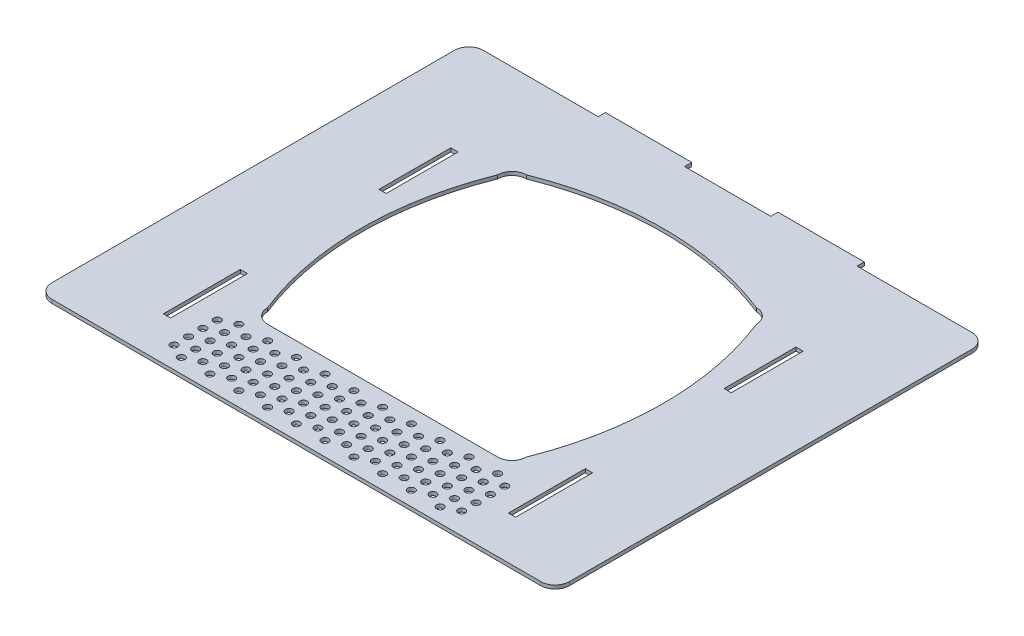
from build123d import *

# Parameters (mm, degrees)
SKETCH1_5_R         = 2.5
SKETCH1_5_W         = 5
SKETCH1_5_H         = 53.5
SKETCH1_5_H_2       = 50
BOSS_EXTRUDE4_DEPTH = 2.5
FILLET1_R           = 10


with BuildPart() as part:
    # Sketch1<5> → Boss-Extrude4 (new body)
    with BuildSketch(Plane(origin=(0, 0, 0), x_dir=(1, 0, 0), z_dir=(0, 1, 0))):
        Polygon((-90, 150), (-180, 150), (-180, -150), (180, -150), (180, 150), (90, 150), (90, 155), (30, 155), (30, 150), (-30, 150), (-30, 155), (-90, 155), align=None)
        with Locations((-90, -140)):
            Circle(SKETCH1_5_R, mode=Mode.SUBTRACT)
        with Locations((-100, -135)):
            Circle(SKETCH1_5_R, mode=Mode.SUBTRACT)
        with Locations((-90, -130)):
            Circle(SKETCH1_5_R, mode=Mode.SUBTRACT)
        with Locations((-100, -125)):
            Circle(SKETCH1_5_R, mode=Mode.SUBTRACT)
        with Locations((-90, -120)):
            Circle(SKETCH1_5_R, mode=Mode.SUBTRACT)
        with Locations((-100, -115)):
            Circle(SKETCH1_5_R, mode=Mode.SUBTRACT)
        with Locations((-120, -93.25)):
            Rectangle(SKETCH1_5_W, SKETCH1_5_H, mode=Mode.SUBTRACT)
        with Locations((-90, -110)):
            Circle(SKETCH1_5_R, mode=Mode.SUBTRACT)
        with Locations((-100, -105)):
            Circle(SKETCH1_5_R, mode=Mode.SUBTRACT)
        with Locations((-90, -100)):
            Circle(SKETCH1_5_R, mode=Mode.SUBTRACT)
        with Locations((-80, -135)):
            Circle(SKETCH1_5_R, mode=Mode.SUBTRACT)
        with Locations((-70, -140)):
            Circle(SKETCH1_5_R, mode=Mode.SUBTRACT)
        with Locations((-60, -135)):
            Circle(SKETCH1_5_R, mode=Mode.SUBTRACT)
        with Locations((-50, -140)):
            Circle(SKETCH1_5_R, mode=Mode.SUBTRACT)
        with Locations((-80, -125)):
            Circle(SKETCH1_5_R, mode=Mode.SUBTRACT)
        with Locations((-70, -130)):
            Circle(SKETCH1_5_R, mode=Mode.SUBTRACT)
        with Locations((-80, -115)):
            Circle(SKETCH1_5_R, mode=Mode.SUBTRACT)
        with Locations((-70, -120)):
            Circle(SKETCH1_5_R, mode=Mode.SUBTRACT)
        with Locations((-60, -125)):
            Circle(SKETCH1_5_R, mode=Mode.SUBTRACT)
        with Locations((-50, -130)):
            Circle(SKETCH1_5_R, mode=Mode.SUBTRACT)
        with Locations((-60, -115)):
            Circle(SKETCH1_5_R, mode=Mode.SUBTRACT)
        with Locations((-50, -120)):
            Circle(SKETCH1_5_R, mode=Mode.SUBTRACT)
        with Locations((-40, -135)):
            Circle(SKETCH1_5_R, mode=Mode.SUBTRACT)
        with Locations((-30, -140)):
            Circle(SKETCH1_5_R, mode=Mode.SUBTRACT)
        with Locations((-20, -135)):
            Circle(SKETCH1_5_R, mode=Mode.SUBTRACT)
        with Locations((-10, -140)):
            Circle(SKETCH1_5_R, mode=Mode.SUBTRACT)
        with Locations((0, -135)):
            Circle(SKETCH1_5_R, mode=Mode.SUBTRACT)
        with Locations((-40, -125)):
            Circle(SKETCH1_5_R, mode=Mode.SUBTRACT)
        with Locations((-30, -130)):
            Circle(SKETCH1_5_R, mode=Mode.SUBTRACT)
        with Locations((-40, -115)):
            Circle(SKETCH1_5_R, mode=Mode.SUBTRACT)
        with Locations((-30, -120)):
            Circle(SKETCH1_5_R, mode=Mode.SUBTRACT)
        with Locations((-20, -125)):
            Circle(SKETCH1_5_R, mode=Mode.SUBTRACT)
        with Locations((-10, -130)):
            Circle(SKETCH1_5_R, mode=Mode.SUBTRACT)
        with Locations((0, -125)):
            Circle(SKETCH1_5_R, mode=Mode.SUBTRACT)
        with Locations((-20, -115)):
            Circle(SKETCH1_5_R, mode=Mode.SUBTRACT)
        with Locations((-10, -120)):
            Circle(SKETCH1_5_R, mode=Mode.SUBTRACT)
        with Locations((0, -115)):
            Circle(SKETCH1_5_R, mode=Mode.SUBTRACT)
        with Locations((-80, -105)):
            Circle(SKETCH1_5_R, mode=Mode.SUBTRACT)
        with Locations((-70, -110)):
            Circle(SKETCH1_5_R, mode=Mode.SUBTRACT)
        with Locations((-70, -100)):
            Circle(SKETCH1_5_R, mode=Mode.SUBTRACT)
        with Locations((-60, -105)):
            Circle(SKETCH1_5_R, mode=Mode.SUBTRACT)
        with Locations((-50, -110)):
            Circle(SKETCH1_5_R, mode=Mode.SUBTRACT)
        with Locations((-50, -100)):
            Circle(SKETCH1_5_R, mode=Mode.SUBTRACT)
        with Locations((-40, -105)):
            Circle(SKETCH1_5_R, mode=Mode.SUBTRACT)
        with Locations((-30, -110)):
            Circle(SKETCH1_5_R, mode=Mode.SUBTRACT)
        with Locations((-30, -100)):
            Circle(SKETCH1_5_R, mode=Mode.SUBTRACT)
        with Locations((-20, -105)):
            Circle(SKETCH1_5_R, mode=Mode.SUBTRACT)
        with Locations((-10, -110)):
            Circle(SKETCH1_5_R, mode=Mode.SUBTRACT)
        with Locations((0, -105)):
            Circle(SKETCH1_5_R, mode=Mode.SUBTRACT)
        with Locations((-10, -100)):
            Circle(SKETCH1_5_R, mode=Mode.SUBTRACT)
        with Locations((10, -140)):
            Circle(SKETCH1_5_R, mode=Mode.SUBTRACT)
        with Locations((20, -135)):
            Circle(SKETCH1_5_R, mode=Mode.SUBTRACT)
        with Locations((30, -140)):
            Circle(SKETCH1_5_R, mode=Mode.SUBTRACT)
        with Locations((40, -135)):
            Circle(SKETCH1_5_R, mode=Mode.SUBTRACT)
        with Locations((10, -130)):
            Circle(SKETCH1_5_R, mode=Mode.SUBTRACT)
        with Locations((20, -125)):
            Circle(SKETCH1_5_R, mode=Mode.SUBTRACT)
        with Locations((10, -120)):
            Circle(SKETCH1_5_R, mode=Mode.SUBTRACT)
        with Locations((20, -115)):
            Circle(SKETCH1_5_R, mode=Mode.SUBTRACT)
        with Locations((30, -130)):
            Circle(SKETCH1_5_R, mode=Mode.SUBTRACT)
        with Locations((40, -125)):
            Circle(SKETCH1_5_R, mode=Mode.SUBTRACT)
        with Locations((30, -120)):
            Circle(SKETCH1_5_R, mode=Mode.SUBTRACT)
        with Locations((40, -115)):
            Circle(SKETCH1_5_R, mode=Mode.SUBTRACT)
        with Locations((50, -140)):
            Circle(SKETCH1_5_R, mode=Mode.SUBTRACT)
        with Locations((60, -135)):
            Circle(SKETCH1_5_R, mode=Mode.SUBTRACT)
        with Locations((70, -140)):
            Circle(SKETCH1_5_R, mode=Mode.SUBTRACT)
        with Locations((90, -140)):
            Circle(SKETCH1_5_R, mode=Mode.SUBTRACT)
        with Locations((80, -135)):
            Circle(SKETCH1_5_R, mode=Mode.SUBTRACT)
        with Locations((50, -130)):
            Circle(SKETCH1_5_R, mode=Mode.SUBTRACT)
        with Locations((60, -125)):
            Circle(SKETCH1_5_R, mode=Mode.SUBTRACT)
        with Locations((50, -120)):
            Circle(SKETCH1_5_R, mode=Mode.SUBTRACT)
        with Locations((60, -115)):
            Circle(SKETCH1_5_R, mode=Mode.SUBTRACT)
        with Locations((70, -130)):
            Circle(SKETCH1_5_R, mode=Mode.SUBTRACT)
        with Locations((90, -130)):
            Circle(SKETCH1_5_R, mode=Mode.SUBTRACT)
        with Locations((80, -125)):
            Circle(SKETCH1_5_R, mode=Mode.SUBTRACT)
        with Locations((70, -120)):
            Circle(SKETCH1_5_R, mode=Mode.SUBTRACT)
        with Locations((90, -120)):
            Circle(SKETCH1_5_R, mode=Mode.SUBTRACT)
        with Locations((80, -115)):
            Circle(SKETCH1_5_R, mode=Mode.SUBTRACT)
        with Locations((10, -110)):
            Circle(SKETCH1_5_R, mode=Mode.SUBTRACT)
        with Locations((20, -105)):
            Circle(SKETCH1_5_R, mode=Mode.SUBTRACT)
        with Locations((10, -100)):
            Circle(SKETCH1_5_R, mode=Mode.SUBTRACT)
        with Locations((30, -110)):
            Circle(SKETCH1_5_R, mode=Mode.SUBTRACT)
        with Locations((40, -105)):
            Circle(SKETCH1_5_R, mode=Mode.SUBTRACT)
        with Locations((30, -100)):
            Circle(SKETCH1_5_R, mode=Mode.SUBTRACT)
        with Locations((50, -110)):
            Circle(SKETCH1_5_R, mode=Mode.SUBTRACT)
        with Locations((60, -105)):
            Circle(SKETCH1_5_R, mode=Mode.SUBTRACT)
        with Locations((50, -100)):
            Circle(SKETCH1_5_R, mode=Mode.SUBTRACT)
        with Locations((70, -110)):
            Circle(SKETCH1_5_R, mode=Mode.SUBTRACT)
        with Locations((90, -110)):
            Circle(SKETCH1_5_R, mode=Mode.SUBTRACT)
        with Locations((80, -105)):
            Circle(SKETCH1_5_R, mode=Mode.SUBTRACT)
        with Locations((70, -100)):
            Circle(SKETCH1_5_R, mode=Mode.SUBTRACT)
        with Locations((90, -100)):
            Circle(SKETCH1_5_R, mode=Mode.SUBTRACT)
        with Locations((100, -135)):
            Circle(SKETCH1_5_R, mode=Mode.SUBTRACT)
        with Locations((100, -125)):
            Circle(SKETCH1_5_R, mode=Mode.SUBTRACT)
        with Locations((100, -115)):
            Circle(SKETCH1_5_R, mode=Mode.SUBTRACT)
        with Locations((100, -105)):
            Circle(SKETCH1_5_R, mode=Mode.SUBTRACT)
        with Locations((120, -93.25)):
            Rectangle(SKETCH1_5_W, SKETCH1_5_H, mode=Mode.SUBTRACT)
        with Locations((-120, 55)):
            Rectangle(SKETCH1_5_W, SKETCH1_5_H_2, mode=Mode.SUBTRACT)
        with BuildLine():
            ThreePointArc((-90, 80), (-87.071067812, 87.071067812), (-80, 90))
            ThreePointArc((-80, 90), (0, 105.314802235), (80, 90))
            ThreePointArc((80, 90), (87.071067812, 87.071067812), (90, 80))
            ThreePointArc((90, 80), (105.314802235, 0), (90, -80))
            ThreePointArc((90, -80), (87.071067812, -87.071067812), (80, -90))
            Line((80, -90), (-80, -90))
            ThreePointArc((-80, -90), (-87.071067812, -87.071067812), (-90, -80))
            ThreePointArc((-90, -80), (-105.314802235, 0), (-90, 80))
        make_face(mode=Mode.SUBTRACT)
        with Locations((120, 55)):
            Rectangle(SKETCH1_5_W, SKETCH1_5_H_2, mode=Mode.SUBTRACT)
    extrude(amount=BOSS_EXTRUDE4_DEPTH)

    # Fillet1
    fillet1_edges = [part.edges().sort_by_distance(p)[0] for p in [
        (180, 1.25, -150),
        (180, 1.25, 150),
        (-180, 1.25, -150),
        (-180, 1.25, 150),
    ]]
    fillet(fillet1_edges, radius=FILLET1_R)


solid = part.part
